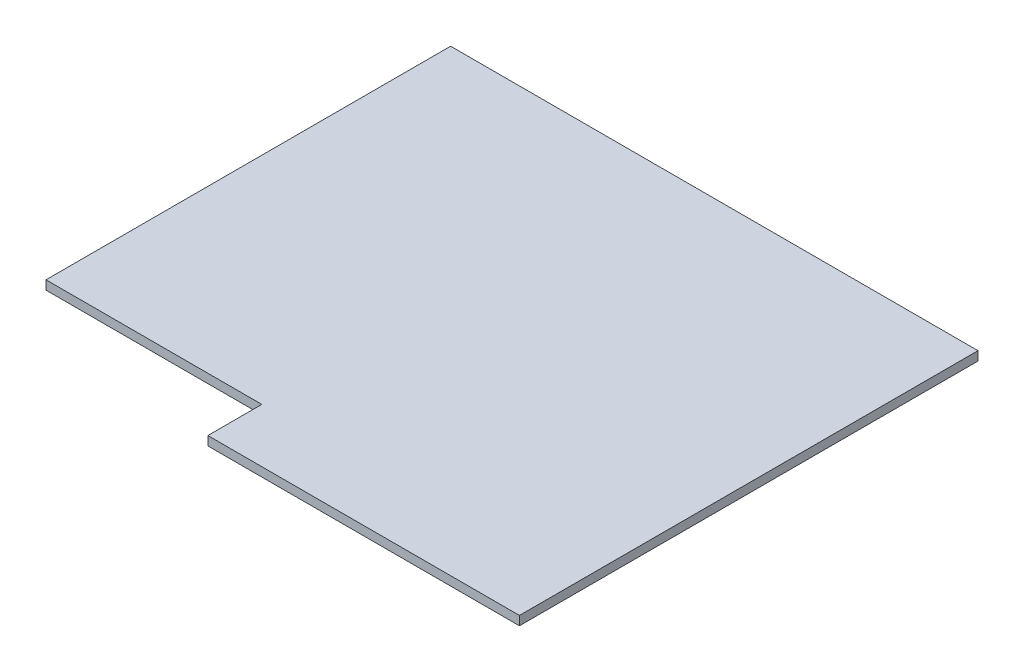
from build123d import *

# Parameters (mm, degrees)
BOSS_EXTRUDE1_DEPTH = 5


with BuildPart() as part:
    # Sketch1 → Boss-Extrude1 (new body)
    with BuildSketch(Plane(origin=(0, 0, 0), x_dir=(1, 0, 0), z_dir=(0, 1, 0))):
        Polygon((-206.635, -97.5), (-86.635, -97.5), (-86.635, -127.5), (86.635, -127.5), (86.635, 127.5), (-206.635, 127.5), align=None)
    extrude(amount=BOSS_EXTRUDE1_DEPTH)


solid = part.part
